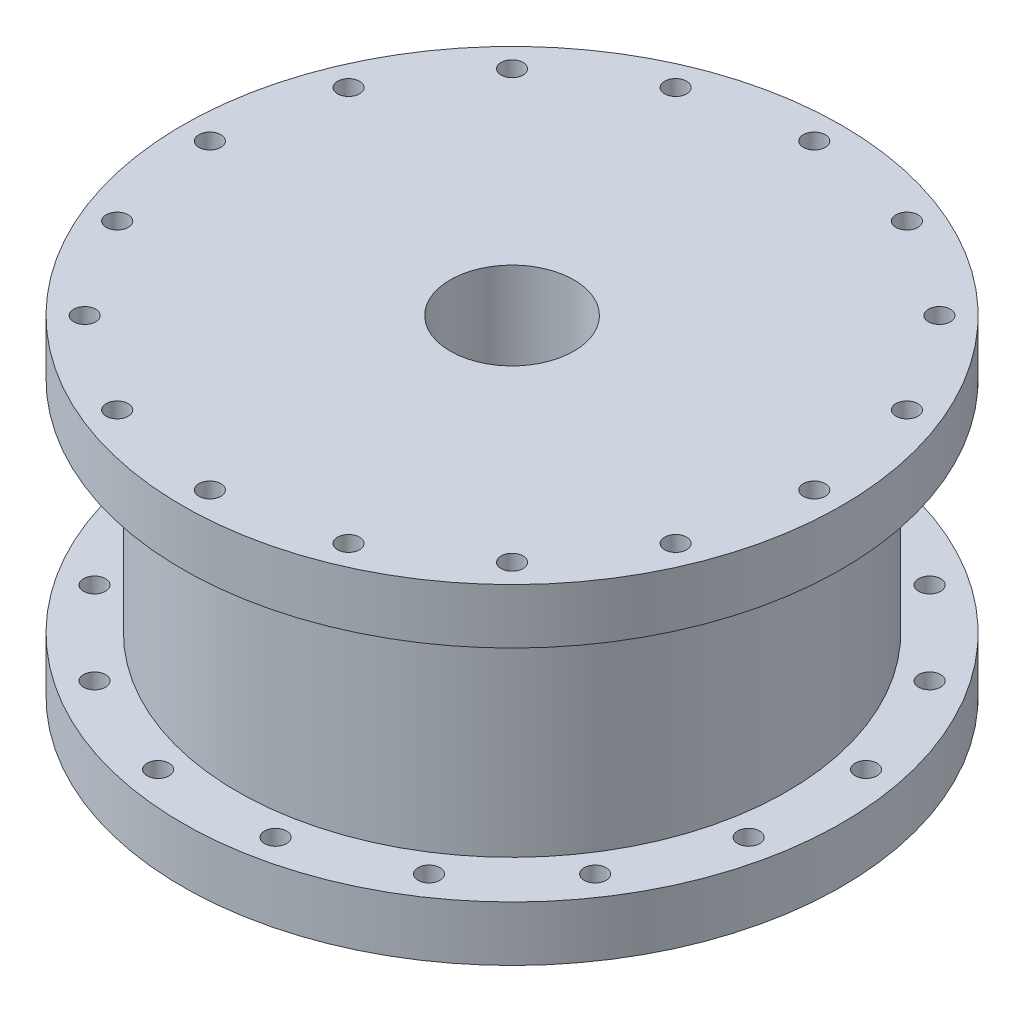
from build123d import *

# Parameters (mm, degrees)
SKETCH4_R          = 5.621513677
CUT_EXTRUDE1_DEPTH = 52.929197644
SKETCH5_R          = 1
CUT_EXTRUDE2_DEPTH = 50.210177484
CIRPATTERN2_COUNT  = 16
CUT_EXTRUDE3_REACH = 53.929
SKETCH7_R          = 1
CIRPATTERN3_COUNT  = 16


with BuildPart() as part:
    # Sketch3 → Revolve1 (revolve)
    with BuildSketch(Plane(origin=(0, 0, 0), x_dir=(0, 0, -1), z_dir=(1, 0, 0))):
        Polygon((0, 30), (0, 0), (29.972, 0), (29.972, 5), (24.993307857, 5), (24.993307857, 25), (29.972, 25), (29.972, 30), align=None)
    revolve(axis=Axis((0, 30, 0), (0, 1, 0)))

    # Sketch4 → Cut-Extrude1 (cut, through all)
    with BuildSketch(Plane(origin=(0, 30, 0), x_dir=(1, 0, 0), z_dir=(0, 1, 0))):
        Circle(SKETCH4_R)
    extrude(amount=-CUT_EXTRUDE1_DEPTH, mode=Mode.SUBTRACT)

    # Sketch5 → Cut-Extrude2 (cut, through all)
    with BuildSketch(Plane.XZ.offset(-25)):
        with Locations((0, 27.482653928)):
            Circle(SKETCH5_R)
    cut_extrude2 = extrude(amount=-CUT_EXTRUDE2_DEPTH, mode=Mode.SUBTRACT)

    # CirPattern2: Cut-Extrude2 ×16 about axis
    cirpattern2_axis = Axis((0, 0, 0), (0, 1, 0))
    for i in range(1, CIRPATTERN2_COUNT):
        add(cut_extrude2.rotate(cirpattern2_axis, i * 360 / CIRPATTERN2_COUNT), mode=Mode.SUBTRACT)

    # Sketch7 → Cut-Extrude3 (cut, up to next)
    with BuildSketch(Plane.XZ, mode=Mode.PRIVATE) as cut_extrude3_sk1:
        with Locations((-5.341086171, 26.85145344)):
            Circle(SKETCH7_R)
    cut_extrude3_tool1 = extrude(cut_extrude3_sk1.sketch, amount=-CUT_EXTRUDE3_REACH, mode=Mode.PRIVATE) & part.part
    cut_extrude3 = cut_extrude3_tool1.solids().sort_by_distance((-5.341086, 0, 26.851453))[0]
    add(cut_extrude3, mode=Mode.SUBTRACT)

    # CirPattern3: Cut-Extrude3 ×16 about axis
    cirpattern3_axis = Axis((0, 0, 0), (0, 1, 0))
    for i in range(1, CIRPATTERN3_COUNT):
        add(cut_extrude3.rotate(cirpattern3_axis, i * 360 / CIRPATTERN3_COUNT), mode=Mode.SUBTRACT)


solid = part.part
